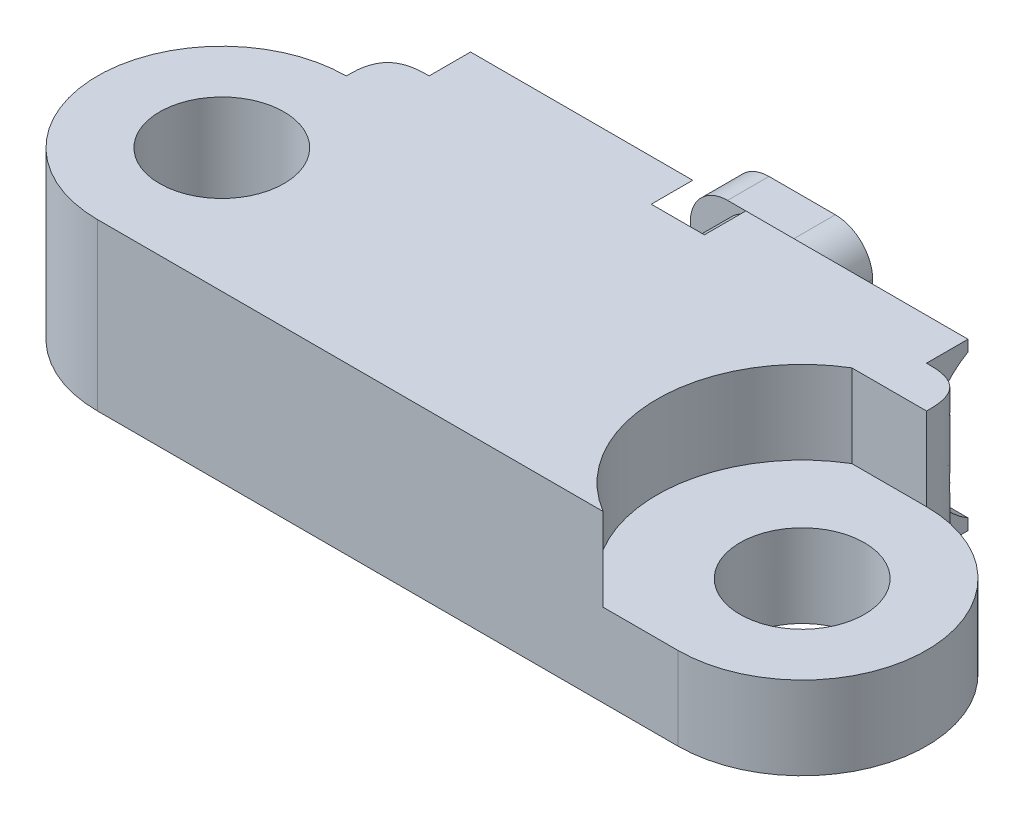
from build123d import *

# Parameters (mm, degrees)
SKETCH1_R                = 1.5
BOSS_EXTRUDE1_DEPTH      = 2
CUT_EXTRUDE1_DEPTH       = 2
BOSS_EXTRUDE2_REACH      = 13.18
SKETCH3_W                = 14
SKETCH3_H                = 1
FILLET1_SIZE             = 1
BOSS_EXTRUDE3_DEPTH      = 6
BOSS_EXTRUDE3_DEPTH_BACK = 6
CUT_EXTRUDE4_START       = -4
SKETCH5_R                = 2.1
CUT_EXTRUDE4_DEPTH       = 10
SKETCH6_R                = 1
BOSS_EXTRUDE5_DEPTH      = 3
BOSS_EXTRUDE6_START      = 2
BOSS_EXTRUDE6_DEPTH      = 1


with BuildPart() as part:
    # Sketch1 → Boss-Extrude1 (new, symmetric)
    with BuildSketch(Plane(origin=(0, 0, 0), x_dir=(1, 0, 0), z_dir=(0, 1, 0))):
        with BuildLine():
            Line((-7, 3), (7, 3))
            ThreePointArc((7, 3), (10, 0), (7, -3))
            Line((7, -3), (-7, -3))
            ThreePointArc((-7, -3), (-10, 0), (-7, 3))
        make_face()
        with Locations(Location((-7, 0, 0), (0, 0, 270))):
            Circle(SKETCH1_R, mode=Mode.SUBTRACT)
        with Locations(Location((7, 0, 0), (0, 0, 270))):
            Circle(SKETCH1_R, mode=Mode.SUBTRACT)
    extrude(amount=BOSS_EXTRUDE1_DEPTH, both=True)

    # Sketch2 → Cut-Extrude1 (cut)
    with BuildSketch(Plane(origin=(0, 2, 0), x_dir=(1, 0, 0), z_dir=(0, 1, 0))):
        with BuildLine():
            Line((5.197224362, 3), (7, 3))
            ThreePointArc((7, 3), (10, 0), (7, -3))
            Line((7, -3), (5.197224362, -3))
            ThreePointArc((5.197224362, -3), (3.5, 0), (5.197224362, 3))
        make_face()
    extrude(amount=-CUT_EXTRUDE1_DEPTH, mode=Mode.SUBTRACT)

    # Boss-Extrude2: up to this face of the body (flat: up to its plane)
    boss_extrude2_end = Plane(part.part.faces().sort_by_distance((-2.270949872, 2, 0))[0])
    # Sketch3 → Boss-Extrude2 (add, up to the picked face)
    with BuildSketch(Plane.XZ.offset(2), mode=Mode.PRIVATE) as boss_extrude2_sk1:
        with Locations((0, -3.5)):
            Rectangle(SKETCH3_W, SKETCH3_H)
    boss_extrude2_tool1 = split(extrude(boss_extrude2_sk1.sketch, amount=-BOSS_EXTRUDE2_REACH, mode=Mode.PRIVATE), bisect_by=boss_extrude2_end, keep=Keep.BOTH, mode=Mode.PRIVATE)
    add(boss_extrude2_tool1.solids().sort_by(Axis((0, -2, -3.5), (0, 1, 0)))[0])

    # Fillet1
    # a fillet whose section is not a circle: 1 mm, written as the material it takes off along each edge
    with BuildSketch(Plane(origin=(7, -4.5, -4), x_dir=(0, 0, 1), z_dir=(0, 1, 0)), Plane(origin=(-7, -4.5, -4), x_dir=(1, 0, 0), z_dir=(0, 1, 0))) as fillet1_piece_1:
        with BuildLine():
            add(Edge.make_bspline([(FILLET1_SIZE, 0), (FILLET1_SIZE * 0.831801948466, 0), (FILLET1_SIZE * 0.663603896932, 0), (FILLET1_SIZE * 0.292893218813, -FILLET1_SIZE * 0.0716919198361), (FILLET1_SIZE * 0.0716919198361, -FILLET1_SIZE * 0.292893218813), (0, -FILLET1_SIZE * 0.663603896932), (0, -FILLET1_SIZE * 0.831801948466), (0, -FILLET1_SIZE)], knots=[0, 0, 0, 0, 0, 0, 0.5, 0.5, 1, 1, 1, 1, 1, 1], degree=5))
            Line((0, -FILLET1_SIZE), (0, 0))
            Line((0, 0), (FILLET1_SIZE, 0))
        make_face()
    extrude(amount=9, mode=Mode.SUBTRACT)

    # Sketch4 → Boss-Extrude3 (add, two sides: drawn at the far end of the back side and taken through both)
    with BuildSketch(Plane(origin=(0, 0, 0), x_dir=(0, 0, -1), z_dir=(1, 0, 0)).offset(-BOSS_EXTRUDE3_DEPTH_BACK)):
        with BuildLine():
            Line((5, 2), (4, 2))
            Line((4, 2), (4, 0))
            ThreePointArc((4, 0), (4.267949192, 1), (5, 1.732050808))
            Line((5, 1.732050808), (5, 2))
        make_face()
        with BuildLine():
            ThreePointArc((5, -1.732050808), (4.267949192, -1), (4, 0))
            Line((4, 0), (4, -2))
            Line((4, -2), (5, -2))
            Line((5, -2), (5, -1.732050808))
        make_face()
    extrude(amount=BOSS_EXTRUDE3_DEPTH + BOSS_EXTRUDE3_DEPTH_BACK)

    # Sketch5 → Cut-Extrude4 (cut)
    with BuildSketch(Plane.XY.offset(CUT_EXTRUDE4_START)):
        Circle(SKETCH5_R)
    extrude(amount=-CUT_EXTRUDE4_DEPTH, mode=Mode.SUBTRACT)

    # Sketch6 → Boss-Extrude5 (add)
    with BuildSketch(Plane(origin=(0, 0, -4), x_dir=(-1, 0, 0), z_dir=(0, 0, -1))):
        with Locations(Location((0, 0, 0), (0, 0, 180))):
            Circle(SKETCH6_R)
    extrude(amount=BOSS_EXTRUDE5_DEPTH)

    # Sketch6<3> → Boss-Extrude6 (add)
    with BuildSketch(Plane(origin=(0, 0, -4), x_dir=(-1, 0, 0), z_dir=(0, 0, -1)).offset(BOSS_EXTRUDE6_START)):
        with BuildLine():
            Line((0.8, 1), (0, 1))
            ThreePointArc((0, 1), (0.707106781, 0.707106781), (1, 0))
            ThreePointArc((1, 0), (0.707106781, -0.707106781), (0, -1))
            Line((0, -1), (0.8, -1))
            ThreePointArc((0.8, -1), (1.436396103, -0.736396103), (1.7, -0.1))
            Line((1.7, -0.1), (1.7, 0.1))
            ThreePointArc((1.7, 0.1), (1.436396103, 0.736396103), (0.8, 1))
        make_face()
        with BuildLine():
            ThreePointArc((0, -1), (-1, 0), (0, 1))
            Line((0, 1), (-0.8, 1))
            ThreePointArc((-0.8, 1), (-1.436396103, 0.736396103), (-1.7, 0.1))
            Line((-1.7, 0.1), (-1.7, -0.1))
            ThreePointArc((-1.7, -0.1), (-1.436396103, -0.736396103), (-0.8, -1))
            Line((-0.8, -1), (0, -1))
        make_face()
    extrude(amount=BOSS_EXTRUDE6_DEPTH)


solid = part.part
